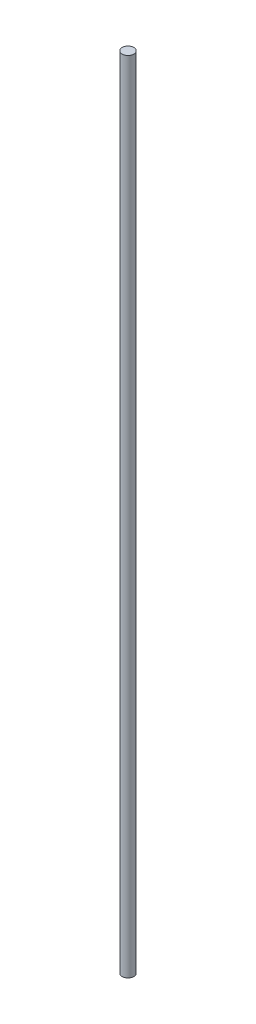
from build123d import *

# Parameters (mm, degrees)
SKETCH1_R           = 2
BOSS_EXTRUDE1_DEPTH = 275


with BuildPart() as part:
    # Sketch1 → Boss-Extrude1 (new body)
    with BuildSketch(Plane(origin=(0, 0, 0), x_dir=(1, 0, 0), z_dir=(0, 1, 0))):
        Circle(SKETCH1_R)
    extrude(amount=BOSS_EXTRUDE1_DEPTH)


solid = part.part
